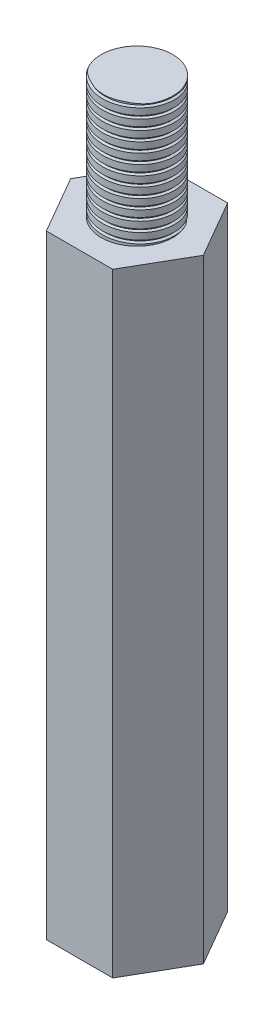
from build123d import *

# Parameters (mm, degrees)
SKETCH_1_R          = 1.46
EXTRUDE_1_DEPTH     = 25
SKETCH_1_3_R        = 1.46
CUT_EXTRUDE_1_DEPTH = 5
SKETCH_2_R          = 1.46
EXTRUDE_2_DEPTH     = 5
SWEEP_1_PITCH       = 0.4
SWEEP_1_FROM        = -0.1
SWEEP_2_PITCH       = 0.4


with BuildPart() as part:
    # 草图1 → 凸台-拉伸1 (new body)
    # profile 1 of 2: a face of its own
    with BuildSketch(Plane(origin=(0, 0, 0), x_dir=(1, 0, 0), z_dir=(0, 1, 0))):
        Polygon((-2.70199926, 0), (-1.35099963, -2.34), (1.35099963, -2.34), (2.70199926, 0), (1.35099963, 2.34), (-1.35099963, 2.34), align=None)
        Circle(SKETCH_1_R, mode=Mode.SUBTRACT)
    # profile 2 of 2: a face of its own
    with BuildSketch(Plane(origin=(0, 0, 0), x_dir=(1, 0, 0), z_dir=(0, 1, 0))):
        Circle(SKETCH_1_R)
    extrude(amount=EXTRUDE_1_DEPTH)

    # 草图1<3> → 切除-拉伸1 (cut)
    with BuildSketch(Plane(origin=(0, 0, 0), x_dir=(1, 0, 0), z_dir=(0, 1, 0))):
        with Locations(Location((0, 0, 0), (0, 0, 270))):
            Circle(SKETCH_1_3_R)
    extrude(amount=CUT_EXTRUDE_1_DEPTH, mode=Mode.SUBTRACT)

    # 切除-扫描2: arcs per turn and ends read off the stored shape
    # 切除-扫描2: the profile of 草图7 profile screwed along a right-hand helix through 23.75 turns, 6 arcs to a turn; built about Z, then put on its axis
    sweep_2_z = Axis((0, 0, 0), (0, 0, 1))
    sweep_2_corners = [(1.4597, 0, 0.1001), (1.66, 0, 0.033333333), (1.66, 0, -0.033333333), (1.4597, 0, -0.1001)]
    with BuildLine(mode=Mode.PRIVATE) as sweep_2_profile:
        Line(sweep_2_corners[0], sweep_2_corners[1])
        Line(sweep_2_corners[1], sweep_2_corners[2])
        Line(sweep_2_corners[2], sweep_2_corners[3])
        Line(sweep_2_corners[3], sweep_2_corners[0])
    sweep_2_cap = Face(sweep_2_profile.wire())
    sweep_2_turn_angles = [0, 30, 60, 90, 120, 150, 180, 210, 240, 270, 300, 330, 360]
    sweep_2_turn_weights = [1, 0.8660254037844387, 1, 0.8660254037844387, 1, 0.8660254037844387, 1, 0.8660254037844387, 1, 0.8660254037844387, 1, 0.8660254037844387, 1]
    sweep_2_turn_rails = [Edge.make_bspline([Vector(p[0], p[1], 0).rotate(sweep_2_z, sweep_2_turn_angles[k]) / sweep_2_turn_weights[k] + Vector(0, 0, p[2] + SWEEP_2_PITCH * sweep_2_turn_angles[k] / 360) for k in range(13)], [0, 0, 0, 1, 1, 2, 2, 3, 3, 4, 4, 5, 5, 6, 6, 6], 2, sweep_2_turn_weights) for p in sweep_2_corners]
    sweep_2_turn_sides = [Face.make_surface_from_curves(sweep_2_turn_rails[p[0]], sweep_2_turn_rails[p[1]]) for p in [(0, 1), (1, 2), (2, 3), (3, 0)]]
    sweep_2_last_angles = [8280, 8310, 8340, 8370, 8400, 8430, 8460, 8490, 8520, 8535, 8550]
    sweep_2_last_weights = [1, 0.8660254037844387, 1, 0.8660254037844387, 1, 0.8660254037844387, 1, 0.8660254037844387, 1, 0.965925826289056, 1]
    sweep_2_last_rails = [Edge.make_bspline([Vector(p[0], p[1], 0).rotate(sweep_2_z, sweep_2_last_angles[k]) / sweep_2_last_weights[k] + Vector(0, 0, p[2] + SWEEP_2_PITCH * sweep_2_last_angles[k] / 360) for k in range(11)], [0, 0, 0, 1, 1, 2, 2, 3, 3, 4, 4, 5, 5, 5], 2, sweep_2_last_weights) for p in sweep_2_corners]
    sweep_2_last_sides = [Face.make_surface_from_curves(sweep_2_last_rails[p[0]], sweep_2_last_rails[p[1]]) for p in [(0, 1), (1, 2), (2, 3), (3, 0)]]
    sweep_2 = Plane(origin=(0, 0, 0), x_dir=(0, 0, -1), z_dir=(0, 1, 0)) * Solid(Shell([*[p.moved(Location((0, 0, SWEEP_2_PITCH * i))) for i in range(23) for p in sweep_2_turn_sides], *sweep_2_last_sides, sweep_2_cap, sweep_2_cap.rotate(sweep_2_z, 8550).moved(Location((0, 0, SWEEP_2_PITCH * 8550 / 360)))]))
    add(sweep_2, mode=Mode.SUBTRACT)


with BuildPart() as body_2:
    # 草图2 → 凸台-拉伸2 (new body)
    with BuildSketch(Plane(origin=(0, 25, 0), x_dir=(1, 0, 0), z_dir=(0, 1, 0))):
        with Locations(Location((0, 0, 0), (0, 0, 270))):
            Circle(SKETCH_2_R)
    extrude(amount=EXTRUDE_2_DEPTH)

    # 切除-扫描1: arcs per turn and ends read off the stored shape
    # 切除-扫描1: the profile of 草图4 screwed along a left-hand helix through 18.75 turns, 6 arcs to a turn; built about Z, then put on its axis
    sweep_1_z = Axis((0, 0, 0), (0, 0, 1))
    sweep_1_corners = [(1.56, 5.45e-07, -0.400000022), (1.56, 5.45e-07, -0.200000022), (1.36, 4.75e-07, -0.266666689), (1.36, 4.75e-07, -0.333333356)]
    with BuildLine(mode=Mode.PRIVATE) as sweep_1_profile:
        Line(sweep_1_corners[0], sweep_1_corners[1])
        Line(sweep_1_corners[1], sweep_1_corners[2])
        Line(sweep_1_corners[2], sweep_1_corners[3])
        Line(sweep_1_corners[3], sweep_1_corners[0])
    sweep_1_cap = Face(sweep_1_profile.wire())
    sweep_1_turn_angles = [0, -30, -60, -90, -120, -150, -180, -210, -240, -270, -300, -330, -360]
    sweep_1_turn_weights = [1, 0.8660254037844387, 1, 0.8660254037844387, 1, 0.8660254037844387, 1, 0.8660254037844387, 1, 0.8660254037844387, 1, 0.8660254037844387, 1]
    sweep_1_turn_rails = [Edge.make_bspline([Vector(p[0], p[1], 0).rotate(sweep_1_z, sweep_1_turn_angles[k]) / sweep_1_turn_weights[k] + Vector(0, 0, p[2] + -SWEEP_1_PITCH * sweep_1_turn_angles[k] / 360) for k in range(13)], [0, 0, 0, 1, 1, 2, 2, 3, 3, 4, 4, 5, 5, 6, 6, 6], 2, sweep_1_turn_weights) for p in sweep_1_corners]
    sweep_1_turn_sides = [Face.make_surface_from_curves(sweep_1_turn_rails[p[0]], sweep_1_turn_rails[p[1]]) for p in [(0, 1), (1, 2), (2, 3), (3, 0)]]
    sweep_1_last_angles = [-6480, -6510, -6540, -6570, -6600, -6630, -6660, -6690, -6720, -6735, -6750]
    sweep_1_last_weights = [1, 0.8660254037844387, 1, 0.8660254037844387, 1, 0.8660254037844387, 1, 0.8660254037844387, 1, 0.9659258262889348, 1]
    sweep_1_last_rails = [Edge.make_bspline([Vector(p[0], p[1], 0).rotate(sweep_1_z, sweep_1_last_angles[k]) / sweep_1_last_weights[k] + Vector(0, 0, p[2] + -SWEEP_1_PITCH * sweep_1_last_angles[k] / 360) for k in range(11)], [0, 0, 0, 1, 1, 2, 2, 3, 3, 4, 4, 5, 5, 5], 2, sweep_1_last_weights) for p in sweep_1_corners]
    sweep_1_last_sides = [Face.make_surface_from_curves(sweep_1_last_rails[p[0]], sweep_1_last_rails[p[1]]) for p in [(0, 1), (1, 2), (2, 3), (3, 0)]]
    sweep_1 = Plane(origin=(0, 25.1, 0), x_dir=(0, 0, 1), z_dir=(0, 1, 0)) * split(Solid(Shell([*[p.moved(Location((0, 0, SWEEP_1_PITCH * i))) for i in range(18) for p in sweep_1_turn_sides], *sweep_1_last_sides, sweep_1_cap, sweep_1_cap.rotate(sweep_1_z, -6750).moved(Location((0, 0, -SWEEP_1_PITCH * -6750 / 360)))])), bisect_by=Plane.XY.offset(SWEEP_1_FROM), keep=Keep.TOP, mode=Mode.PRIVATE)
    add(sweep_1, mode=Mode.SUBTRACT)


solid = Compound([part.part, body_2.part])
